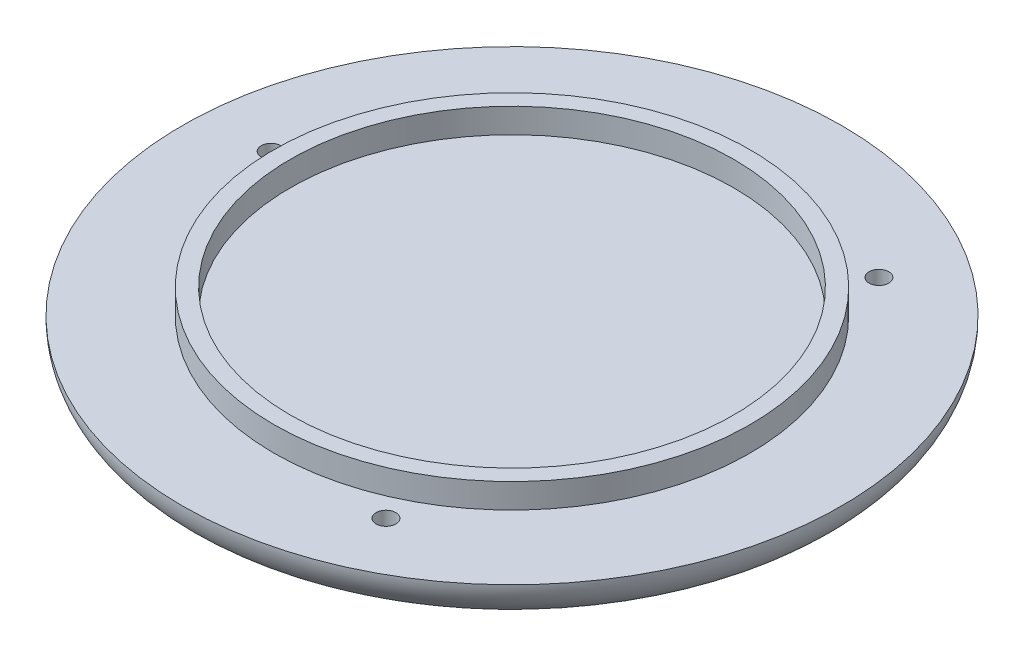
from build123d import *

# Parameters (mm, degrees)
SKETCH_1_R                = 40
EXTRUDE_1_DEPTH           = 5
SKETCH_2_R                = 28.9
EXTRUDE_2_DEPTH           = 3
HOLE_WIZARD_1_D           = 2.4
HOLE_WIZARD_1_CBORE_D     = 4.3
HOLE_WIZARD_1_CBORE_DEPTH = 2.3
PATTERN_CIRCULAR_1_COUNT  = 3
SKETCH_7_R                = 26.9
CUT_EXTRUDE_1_DEPTH       = 3
FILLET_1_R                = 5


with BuildPart() as part:
    # 草图1 → 凸台-拉伸1 (new body)
    with BuildSketch(Plane(origin=(0, 0, 0), x_dir=(1, 0, 0), z_dir=(0, 1, 0))):
        with Locations(Location((0, 0, 0), (0, 0, 270))):
            Circle(SKETCH_1_R)
    extrude(amount=EXTRUDE_1_DEPTH)

    # 草图2 → 凸台-拉伸2 (add)
    with BuildSketch(Plane(origin=(0, 5, 0), x_dir=(1, 0, 0), z_dir=(0, 1, 0))):
        with Locations(Location((0, 0, 0), (0, 0, 270))):
            Circle(SKETCH_2_R)
    extrude(amount=EXTRUDE_2_DEPTH)

    # 打孔尺寸(%根据)内六角圆柱头螺钉的类型1 (through all)
    with Locations(Plane(origin=(0, 0, 0), x_dir=(-1, 0, 0), z_dir=(0, -1, 0))):
        with Locations((-13.645026716, -28.945003816)):
            hole_wizard_1 = CounterBoreHole(HOLE_WIZARD_1_D / 2, HOLE_WIZARD_1_CBORE_D / 2, HOLE_WIZARD_1_CBORE_DEPTH)

    # 阵列(圆周)1: 打孔尺寸(%根据)内六角圆柱头螺钉的类型1 ×3 about axis
    pattern_circular_1_axis = Axis((0, 0, 0), (0, 1, 0))
    for i in range(1, PATTERN_CIRCULAR_1_COUNT):
        add(hole_wizard_1.rotate(pattern_circular_1_axis, i * 360 / PATTERN_CIRCULAR_1_COUNT), mode=Mode.SUBTRACT)

    # 草图7 → 切除-拉伸1 (cut)
    with BuildSketch(Plane(origin=(0, 8, 0), x_dir=(1, 0, 0), z_dir=(0, 1, 0))):
        with Locations(Location((0, 0, 0), (0, 0, 270))):
            Circle(SKETCH_7_R)
    extrude(amount=-CUT_EXTRUDE_1_DEPTH, mode=Mode.SUBTRACT)

    # 圆角1
    fillet_1_edges = [part.edges().sort_by_distance(p)[0] for p in [
        (0, 0, -40),
    ]]
    fillet(fillet_1_edges, radius=FILLET_1_R - 0.0001)  # a hair under: the kernel refuses the full size


solid = part.part
